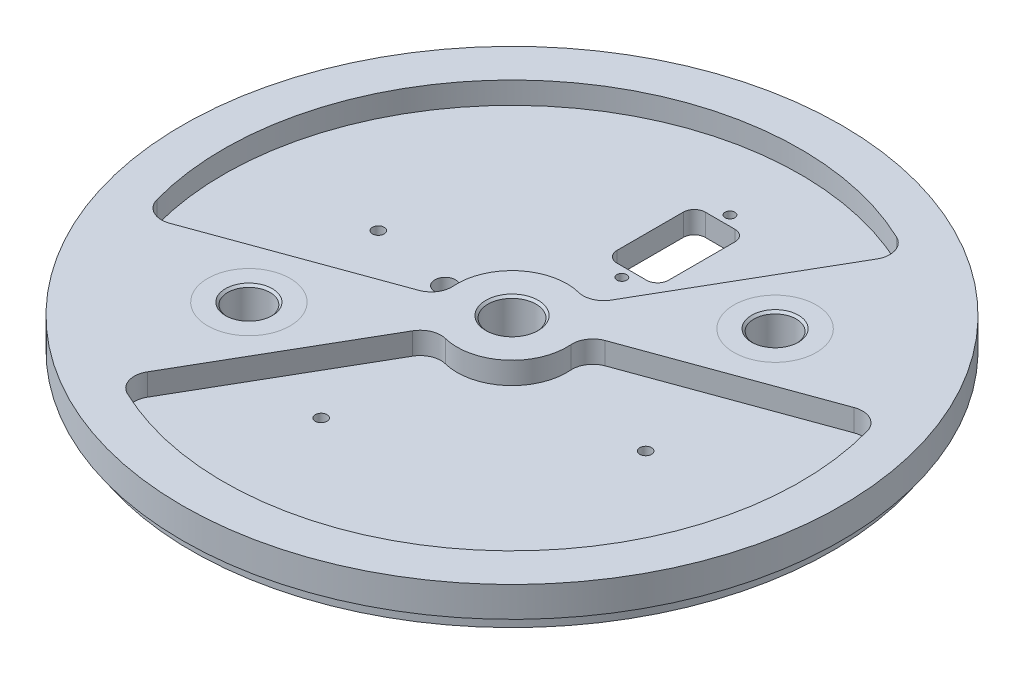
from build123d import *

# Parameters (mm, degrees)
SKETCH1_R                      = 76.2
BOSS_EXTRUDE1_DEPTH            = 10.16
TAP_DRILL_FOR_4_40_TAP1_D      = 2.2606
CUT_EXTRUDE1_DEPTH             = 109.240960824
TAP_DRILL_FOR_6_32_TAP1_D      = 2.7051
CIRPATTERN1_COUNT              = 4
W_0_386_DIAMETER_HOLE1_D       = 9.8044
F_3_16_0_1875_DIAMETER_HOLE1_D = 4.7625
CUT_EXTRUDE4_DEPTH             = 3.175
F_7_16_0_4375_DIAMETER_HOLE1_D = 11.1125
SKETCH15_R                     = 76.2
SKETCH15_R_2                   = 74.041
CUT_EXTRUDE5_DEPTH             = 3.175
CHAMFER2_SIZE                  = 0.508
SKETCH20_R                     = 1.35255
SKETCH20_R_2                   = 2.38125
SKETCH20_R_3                   = 1.1303
CUT_EXTRUDE7_DEPTH             = 5.08


with BuildPart() as part:
    # Sketch1 → Boss-Extrude1 (new body)
    with BuildSketch(Plane(origin=(0, 0, 0), x_dir=(1, 0, 0), z_dir=(0, 1, 0))):
        Circle(SKETCH1_R)
    extrude(amount=BOSS_EXTRUDE1_DEPTH)

    # Tap Drill for #4-40 Tap1 (through all)
    with Locations(Plane(origin=(0, 0, 0), x_dir=(-1, 0, 0), z_dir=(0, -1, 0))):
        with Locations((0, 25.4), (0, 50.400000038)):
            Hole(TAP_DRILL_FOR_4_40_TAP1_D / 2)

    # Sketch2 → Cut-Extrude1 (cut, through all)
    with BuildSketch(Plane.XZ):
        with BuildLine():
            Line((-3.429, -27.686), (3.429, -27.686))
            ThreePointArc((3.429, -27.686), (5.225051224, -28.429948776), (5.969, -30.226))
            Line((5.969, -30.226), (5.969, -45.574000038))
            ThreePointArc((5.969, -45.574000038), (5.225051224, -47.370051262), (3.429, -48.114000038))
            Line((3.429, -48.114000038), (-3.429, -48.114000038))
            ThreePointArc((-3.429, -48.114000038), (-5.225051224, -47.370051262), (-5.969, -45.574000038))
            Line((-5.969, -45.574000038), (-5.969, -30.226))
            ThreePointArc((-5.969, -30.226), (-5.225051224, -28.429948776), (-3.429, -27.686))
        make_face()
    extrude(amount=-CUT_EXTRUDE1_DEPTH, mode=Mode.SUBTRACT)

    # Tap Drill for #6-32 Tap1 (through all)
    with Locations(Plane(origin=(0, 0, 0), x_dir=(-1, 0, 0), z_dir=(0, -1, 0))):
        with Locations((37.52117539, 6.615995569)):
            tap_drill_for_6_32_tap1 = Hole(TAP_DRILL_FOR_6_32_TAP1_D / 2)

    # CirPattern1: Tap Drill for #6-32 Tap1 ×4 about axis, 1 skipped
    cirpattern1_axis = Axis((0, 0, 0), (0, 1, 0))
    add([tap_drill_for_6_32_tap1.rotate(cirpattern1_axis, i * 360 / CIRPATTERN1_COUNT) for i in range(1, CIRPATTERN1_COUNT) if i not in (3,)], mode=Mode.SUBTRACT)

    # W (0.386) Diameter Hole1 (through all)
    with Locations(Plane(origin=(0, 0, 0), x_dir=(-1, 0, 0), z_dir=(0, -1, 0))):
        with Locations((-33.077799054, 27.755568986), (33.077799054, -27.755568986)):
            Hole(W_0_386_DIAMETER_HOLE1_D / 2)

    # 3/16 (0.1875) Diameter Hole1 (through all)
    with Locations(Plane(origin=(0, 0, 0), x_dir=(-1, 0, 0), z_dir=(0, -1, 0))):
        with Locations((18.760587695, 3.307997785)):
            Hole(F_3_16_0_1875_DIAMETER_HOLE1_D / 2)

    # Sketch12 → Cut-Extrude4 (cut)
    with BuildSketch(Plane.XZ):
        with BuildLine():
            Line((19.886888313, 28.738482206), (6.498907978, 12.783308544))
            ThreePointArc((6.498907978, 12.783308544), (6.898075233, 8.220805941), (11.460577836, 8.619973196))
            Line((11.460577836, 8.619973196), (24.848558171, 24.575146858))
            ThreePointArc((24.848558171, 24.575146858), (24.449390916, 29.137649461), (19.886888313, 28.738482206))
        make_face()
    cut_extrude4 = extrude(amount=-CUT_EXTRUDE4_DEPTH, mode=Mode.SUBTRACT)

    # Mirror1: Cut-Extrude4 across plane
    add(cut_extrude4.mirror(Plane(origin=(0, 0, 0), x_dir=(-0.7660444431189792, 0, 0.6427876096865378), z_dir=(0.6427876096865379, 0, 0.7660444431189792))), mode=Mode.SUBTRACT)

    # 7/16 (0.4375) Diameter Hole1 (through all)
    with Locations(Plane(origin=(0, 0, 0), x_dir=(-1, 0, 0), z_dir=(0, -1, 0))):
        with Locations((0, 0)):
            Hole(F_7_16_0_4375_DIAMETER_HOLE1_D / 2)

    # Sketch15 → Cut-Extrude5 (cut)
    with BuildSketch(Plane.XZ):
        Circle(SKETCH15_R)
        Circle(SKETCH15_R_2, mode=Mode.SUBTRACT)
    extrude(amount=-CUT_EXTRUDE5_DEPTH, mode=Mode.SUBTRACT)

    # Chamfer2
    chamfer2_edges = [part.edges().sort_by_distance(p)[0] for p in [
        (-37.979999054, 0, 27.755568986),
        (28.175599054, 0, -27.755568986),
        (-37.979999054, 10.16, 27.755568986),
        (28.175599054, 10.16, -27.755568986),
        (-5.55625, 0, 0),
        (-5.55625, 10.16, 0),
    ]]
    chamfer(chamfer2_edges, length=CHAMFER2_SIZE)

    # Sketch20 → Cut-Extrude7 (cut)
    # profile 1 of 2: a face of its own
    with BuildSketch(Plane(origin=(0, 10.16, 0), x_dir=(1, 0, 0), z_dir=(0, 1, 0))):
        with BuildLine():
            Line((58.006337644, 21.112580301), (15.787325383, 5.746116518))
            ThreePointArc((15.787325383, 5.746116518), (13.41810781, 3.858627578), (12.666324636, 0.92424034))
            ThreePointArc((12.666324636, 0.92424034), (8.163402625, -9.728764443), (-3.109683289, -12.313402042))
            ThreePointArc((-3.109683289, -12.313402042), (-6.130036388, -12.544212982), (-8.400260426, -14.549677855))
            Line((-8.400260426, -14.549677855), (-30.864527746, -53.458930208))
            ThreePointArc((-30.864527746, -53.458930208), (-31.28945063, -57.248955123), (-28.797011077, -60.135578304))
            ThreePointArc((-28.797011077, -60.135578304), (42.857863777, -51.076013328), (64.222532311, 17.917085938))
            ThreePointArc((64.222532311, 17.917085938), (61.812570917, 20.872916849), (58.006337644, 21.112580301))
        make_face()
        with Locations((-6.615995569, -37.52117539)):
            Circle(SKETCH20_R, mode=Mode.SUBTRACT)
        with Locations((37.52117539, -6.615995569)):
            Circle(SKETCH20_R, mode=Mode.SUBTRACT)
    # profile 2 of 2: a face of its own
    with BuildSketch(Plane(origin=(0, 10.16, 0), x_dir=(1, 0, 0), z_dir=(0, 1, 0))):
        with BuildLine():
            ThreePointArc((-12.666324642, -0.924240256), (-8.16340261, 9.728764456), (3.109683246, 12.313402053))
            ThreePointArc((3.109683246, 12.313402053), (6.130036351, 12.544212967), (8.400260408, 14.549677823))
            Line((8.400260408, 14.549677823), (30.864527463, 53.458929718))
            ThreePointArc((30.864527463, 53.458929718), (31.289450636, 57.248955104), (28.797010604, 60.135578531))
            ThreePointArc((28.797010604, 60.135578531), (-42.857863971, 51.076013165), (-64.222532316, -17.91708592))
            ThreePointArc((-64.222532316, -17.91708592), (-61.812570882, -20.872916867), (-58.006337553, -21.112580268))
            Line((-58.006337553, -21.112580268), (-15.787325417, -5.746116531))
            ThreePointArc((-15.787325417, -5.746116531), (-13.418107797, -3.858627558), (-12.666324642, -0.924240256))
        make_face()
        with Locations((-18.760587695, 3.307997785)):
            Circle(SKETCH20_R_2, mode=Mode.SUBTRACT)
        with Locations((-37.52117539, 6.615995569)):
            Circle(SKETCH20_R, mode=Mode.SUBTRACT)
        with Locations((0, 25.4)):
            Circle(SKETCH20_R_3, mode=Mode.SUBTRACT)
        with BuildLine():
            Line((-3.429, 48.114000038), (3.429, 48.114000038))
            ThreePointArc((3.429, 48.114000038), (5.225051224, 47.370051262), (5.969, 45.574000038))
            Line((5.969, 45.574000038), (5.969, 30.226))
            ThreePointArc((5.969, 30.226), (5.225051224, 28.429948776), (3.429, 27.686))
            Line((3.429, 27.686), (-3.429, 27.686))
            ThreePointArc((-3.429, 27.686), (-5.225051224, 28.429948776), (-5.969, 30.226))
            Line((-5.969, 30.226), (-5.969, 45.574000038))
            ThreePointArc((-5.969, 45.574000038), (-5.225051224, 47.370051262), (-3.429, 48.114000038))
        make_face(mode=Mode.SUBTRACT)
        with Locations((0, 50.400000038)):
            Circle(SKETCH20_R_3, mode=Mode.SUBTRACT)
    extrude(amount=-CUT_EXTRUDE7_DEPTH, mode=Mode.SUBTRACT)


solid = part.part
